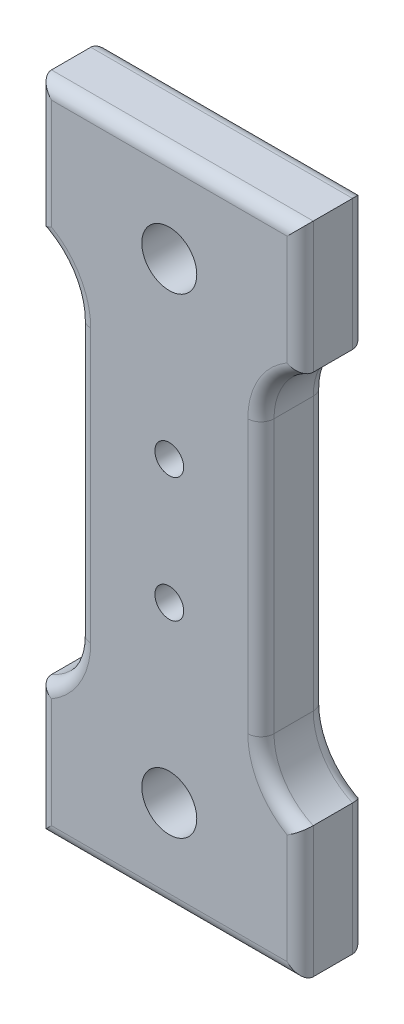
from build123d import *

# Parameters (mm, degrees)
SKETCH1_W            = 20
SKETCH1_H            = 50
BOSS_EXTRUDE1_DEPTH  = 5
SKETCH2_R            = 2.1
SKETCH2_R_2          = 1.1
CUT_EXTRUDE1_DEPTH   = 55.083269132
SKETCH3_W            = 3
SKETCH3_H            = 30
CUT_EXTRUDE2_DEPTH   = 55.083269132
FILLET1_R            = 5
FILLET1_OF_MIRROR1_R = 5
FILLET3_R            = 1


with BuildPart() as part:
    # Sketch1 → Boss-Extrude1 (new body)
    with BuildSketch(Plane.XY):
        with Locations((10, 25)):
            Rectangle(SKETCH1_W, SKETCH1_H)
    extrude(amount=BOSS_EXTRUDE1_DEPTH)

    # Sketch2 → Cut-Extrude1 (cut, through all)
    with BuildSketch(Plane.XY.offset(5)):
        with Locations((10, 43)):
            Circle(SKETCH2_R)
        with Locations((10, 7)):
            Circle(SKETCH2_R)
        with Locations((10, 29.75)):
            Circle(SKETCH2_R_2)
        with Locations((10, 20.25)):
            Circle(SKETCH2_R_2)
    extrude(amount=-CUT_EXTRUDE1_DEPTH, mode=Mode.SUBTRACT)

    # Sketch3 → Cut-Extrude2 (cut, through all)
    with BuildSketch(Plane.XY.offset(5)):
        with Locations((1.5, 25)):
            Rectangle(SKETCH3_W, SKETCH3_H)
    cut_extrude2 = extrude(amount=-CUT_EXTRUDE2_DEPTH, mode=Mode.SUBTRACT)

    # Fillet1
    # the kernel refuses this fillet: 5 mm, written as the material it adds along each edge
    with BuildSketch(Plane(origin=(3, 10, 5), x_dir=(-1, 0, 0), z_dir=(0, 0, -1))) as fillet1_piece_1:
        with BuildLine():
            CenterArc((5, 4.582575695), FILLET1_R, 180, 66.421821522)
            Line((0, 4.582575695), (-0.1, 4.582575695))
            Line((-0.1, 4.582575695), (-0.1, 0))
            Line((-0.1, 0), (0, -0.1))
            ThreePointArc((0, -0.1), (1.5, -0.1), (2.96, -0.091651514))
            Line((2.96, -0.091651514), (3, 0))
        make_face()
    extrude(amount=5)
    with BuildSketch(Plane(origin=(3, 40, 5), x_dir=(0, -1, 0), z_dir=(0, 0, -1))) as fillet1_piece_2:
        with BuildLine():
            CenterArc((4.582575695, 5), FILLET1_R, 203.578178478, 66.421821522)
            Line((0, 3), (-0.091651514, 2.96))
            ThreePointArc((-0.091651514, 2.96), (-0.1, 1.5), (-0.1, 0))
            Line((-0.1, 0), (0, -0.1))
            Line((0, -0.1), (4.582575695, -0.1))
            Line((4.582575695, -0.1), (4.582575695, 0))
        make_face()
    extrude(amount=5)

    # Mirror1: Cut-Extrude2 across plane
    add(cut_extrude2.mirror(Plane.ZY.offset(-10)), mode=Mode.SUBTRACT)

    # Fillet1 of Mirror1
    # the kernel refuses this fillet: 5 mm, written as the material it adds along each edge
    with BuildSketch(Plane(origin=(17, 10, 5), x_dir=(0, 1, 0), z_dir=(0, 0, -1))) as fillet1_of_mirror1_piece_1:
        with BuildLine():
            CenterArc((4.582575695, 5), FILLET1_OF_MIRROR1_R, 203.578178478, 66.421821522)
            Line((0, 3), (-0.091651514, 2.96))
            ThreePointArc((-0.091651514, 2.96), (-0.1, 1.5), (-0.1, 0))
            Line((-0.1, 0), (0, -0.1))
            Line((0, -0.1), (4.582575695, -0.1))
            Line((4.582575695, -0.1), (4.582575695, 0))
        make_face()
    extrude(amount=5)
    with BuildSketch(Plane(origin=(17, 40, 5), x_dir=(1, 0, 0), z_dir=(0, 0, -1))) as fillet1_of_mirror1_piece_2:
        with BuildLine():
            CenterArc((5, 4.582575695), FILLET1_OF_MIRROR1_R, 180, 66.421821522)
            Line((0, 4.582575695), (-0.1, 4.582575695))
            Line((-0.1, 4.582575695), (-0.1, 0))
            Line((-0.1, 0), (0, -0.1))
            ThreePointArc((0, -0.1), (1.5, -0.1), (2.96, -0.091651514))
            Line((2.96, -0.091651514), (3, 0))
        make_face()
    extrude(amount=5)

    # Fillet3
    fillet3_edges = [part.edges().sort_by_distance(p)[0] for p in [
        (20, 5, 5),
        (10, 50, 5),
        (0, 5, 0),
        (0, 5, 5),
        (0, 45, 5),
        (10, 50, 0),
        (3, 25, 5),
        (3, 25, 0),
        (20, 5, 0),
        (2.183300133, 11.843962907, 5),
        (2.183300133, 11.843962907, 0),
        (2.183300133, 38.156037093, 5),
        (2.183300133, 38.156037093, 0),
        (10, 0, 0),
        (0, 45, 0),
        (20, 45, 0),
        (20, 45, 5),
        (10, 0, 5),
        (17, 25, 5),
        (17, 25, 0),
        (17.816699867, 11.843962907, 5),
        (17.816699867, 11.843962907, 0),
        (17.816699867, 38.156037093, 5),
        (17.816699867, 38.156037093, 0),
    ]]
    fillet(fillet3_edges, radius=FILLET3_R)


solid = part.part
